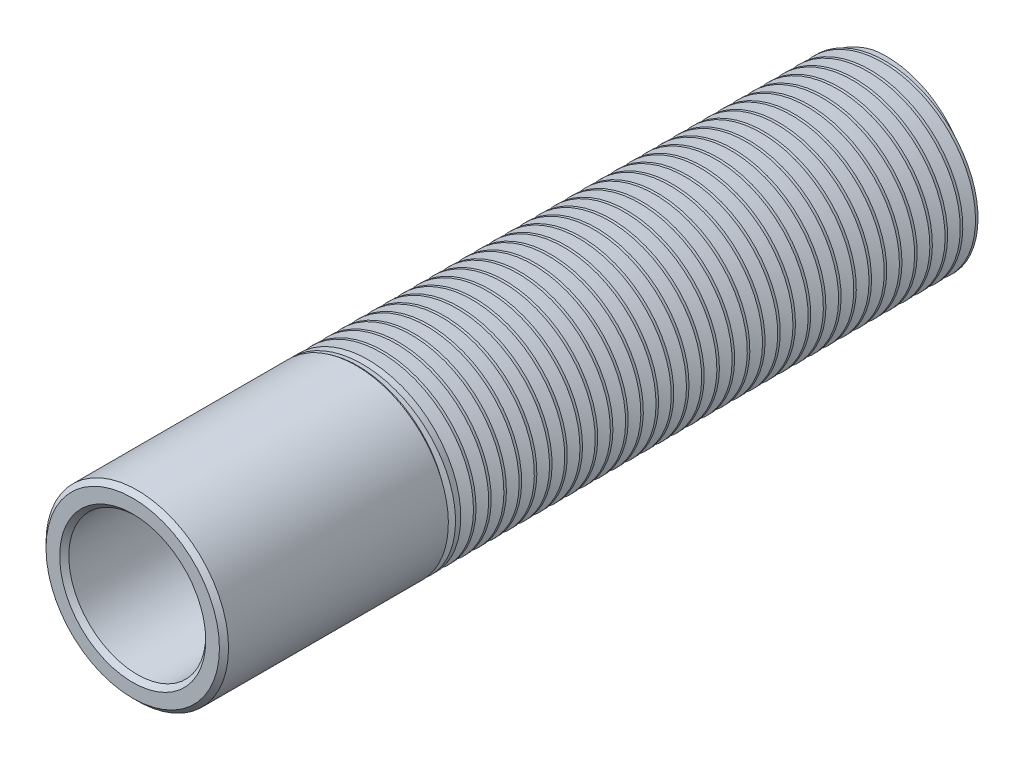
from build123d import *

# Parameters (mm, degrees)
SKETCH1_R              = 6
SKETCH1_R_2            = 4.5
BOSS_EXTRUDE1_DEPTH    = 50
CHAMFER1_SIZE          = 0.3
CUT_SWEEP2_PITCH       = 1
CUT_SWEEP3_PITCH       = 1.414213562
CUT_SWEEP3_HEIGHT      = 1
CUT_SWEEP3_RADIUS      = 6
CUT_SWEEP3_START_ANGLE = 180


with BuildPart() as part:
    # Sketch1 → Boss-Extrude1 (new body)
    with BuildSketch(Plane.XY):
        Circle(SKETCH1_R)
        Circle(SKETCH1_R_2, mode=Mode.SUBTRACT)
    extrude(amount=BOSS_EXTRUDE1_DEPTH)

    # Chamfer1
    chamfer1_edges = [part.edges().sort_by_distance(p)[0] for p in [
        (-6, 0, 0),
        (-6, 0, 50),
        (-4.5, 0, 0),
        (-4.5, 0, 50),
    ]]
    chamfer(chamfer1_edges, length=CHAMFER1_SIZE)

    # Cut-Sweep2: arcs per turn and ends read off the stored shape
    # Cut-Sweep2: the profile of Sketch3 profile screwed along a right-hand helix through 36 turns, 8 arcs to a turn; built about Z, then put on its axis
    cut_sweep2_z = Axis((0, 0, 0), (0, 0, 1))
    cut_sweep2_corners = [(5.075121951, 0, -0.556097561), (6.0003, 0, -0.896952632), (6.0003, 0, -0.063047368), (5.075121951, 0, -0.403902439), (5.04, 0, -0.48)]
    with BuildLine(mode=Mode.PRIVATE) as cut_sweep2_profile:
        Line(cut_sweep2_corners[0], cut_sweep2_corners[1])
        Line(cut_sweep2_corners[1], cut_sweep2_corners[2])
        Line(cut_sweep2_corners[2], cut_sweep2_corners[3])
        ThreePointArc((5.075121951, 0, -0.403902439), (5.049204062, 0, -0.438094182), (5.04, 0, -0.48))
        ThreePointArc((5.04, 0, -0.48), (5.049204062, 0, -0.521905818), (5.075121951, 0, -0.556097561))
    cut_sweep2_cap = Face(cut_sweep2_profile.wire())
    cut_sweep2_arcs = [((5.075121951, 0, -0.403902439), (5.04, 0, -0.433846154), (5.04, 0, -0.48), (1, 0.907959384500452, 1)), ((5.04, 0, -0.48), (5.04, 0, -0.526153846), (5.075121951, 0, -0.556097561), (1, 0.907959384500452, 1))]  # start, shoulder, end, weights
    cut_sweep2_turn_angles = [0, 22.5, 45, 67.5, 90, 112.5, 135, 157.5, 180, 202.5, 225, 247.5, 270, 292.5, 315, 337.5, 360]
    cut_sweep2_turn_weights = [1, 0.9238795325112867, 1, 0.9238795325112867, 1, 0.9238795325112867, 1, 0.9238795325112867, 1, 0.9238795325112867, 1, 0.9238795325112867, 1, 0.9238795325112867, 1, 0.9238795325112867, 1]
    cut_sweep2_turn_rails = [Edge.make_bspline([Vector(p[0], p[1], 0).rotate(cut_sweep2_z, cut_sweep2_turn_angles[k]) / cut_sweep2_turn_weights[k] + Vector(0, 0, p[2] + CUT_SWEEP2_PITCH * cut_sweep2_turn_angles[k] / 360) for k in range(17)], [0, 0, 0, 1, 1, 2, 2, 3, 3, 4, 4, 5, 5, 6, 6, 7, 7, 8, 8, 8], 2, cut_sweep2_turn_weights) for p in cut_sweep2_corners]
    cut_sweep2_turn_sides = [*[Face.make_surface_from_curves(cut_sweep2_turn_rails[p[0]], cut_sweep2_turn_rails[p[1]]) for p in [(0, 1), (1, 2), (2, 3)]], *[Face.make_bezier_surface([[Vector(p[j][0], p[j][1], 0).rotate(cut_sweep2_z, cut_sweep2_turn_angles[2 * i + k]) / cut_sweep2_turn_weights[2 * i + k] + Vector(0, 0, p[j][2] + CUT_SWEEP2_PITCH * cut_sweep2_turn_angles[2 * i + k] / 360) for k in range(3)] for j in range(3)], [[p[3][j] * cut_sweep2_turn_weights[2 * i + k] for k in range(3)] for j in range(3)]) for p in cut_sweep2_arcs for i in range(8)]]
    cut_sweep2 = Plane(origin=(0, 0, -1), x_dir=(-1, 0, 0), z_dir=(0, 0, 1)) * Solid(Shell([*[p.moved(Location((0, 0, CUT_SWEEP2_PITCH * i))) for i in range(36) for p in cut_sweep2_turn_sides], cut_sweep2_cap, cut_sweep2_cap.rotate(cut_sweep2_z, 12960).moved(Location((0, 0, CUT_SWEEP2_PITCH * 12960 / 360)))]))
    add(cut_sweep2, mode=Mode.SUBTRACT)

    # Cut-Sweep3: sweep along a helix
    with BuildLine() as cut_sweep3_path:
        # a taper helix: rise per turn along the axis 1, along the cone's slant (build123d's pitch) 1.414213562
        add(Helix(CUT_SWEEP3_PITCH, CUT_SWEEP3_HEIGHT, CUT_SWEEP3_RADIUS, center=(0, 0, 35), direction=(0, 0, 1), cone_angle=45, mode=Mode.PRIVATE).rotate(Axis((0, 0, 35), (0, 0, 1)), CUT_SWEEP3_START_ANGLE))
    # Sketch5 → Cut-Sweep3 (sweep, cut)
    with BuildSketch(Plane(origin=(0, 0, 0), x_dir=(1, 0, 0), z_dir=(0, 1, 0))):
        with BuildLine():
            Line((-6, -34.103157895), (-6, -34.936842105))
            Line((-6, -34.936842105), (-5.075121951, -34.596097561))
            ThreePointArc((-5.075121951, -34.596097561), (-5.04, -34.52), (-5.075121951, -34.443902439))
            Line((-5.075121951, -34.443902439), (-6, -34.103157895))
        make_face()
    sweep(path=cut_sweep3_path.line, is_frenet=True, mode=Mode.SUBTRACT)


solid = part.part
